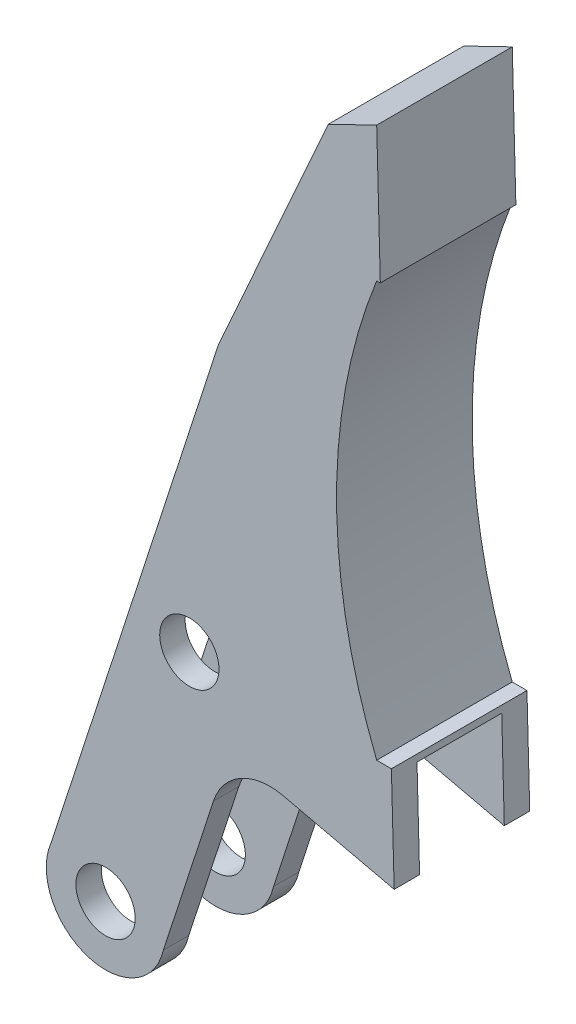
from build123d import *

# Parameters (mm, degrees)
ESTRUSIONE_ESTRUSIONE1_START     = -4
ESTRUSIONE_ESTRUSIONE1_OUTLINE_R = 1.75
ESTRUSIONE_ESTRUSIONE1_DEPTH     = 8
SCHIZZO2_W                       = 5
SCHIZZO2_H                       = 30
TAGLIO_ESTRUSIONE1_DEPTH         = 15


# Read off the part's stored shape, not the designer's step: Estrusione-Estrusione1
with BuildPart() as part:
    # Estrusione-Estrusione1 outline → Estrusione-Estrusione1 (new body)
    with BuildSketch(Plane.XY.offset(ESTRUSIONE_ESTRUSIONE1_START)):
        with BuildLine():
            Line((-25.284658439, 35.888314388), (-18.737560358, 34.376797697))
            Line((-18.737560358, 34.376797697), (-18.90016625, 40.460566904))
            Line((-18.90016625, 40.460566904), (-19.768803662, 40.460566904))
            ThreePointArc((-19.768803662, 40.460566904), (-22.136039573, 52.710253398), (-19.768803662, 64.959939892))
            Line((-19.768803662, 64.959939892), (-19.554981097, 64.959939892))
            Line((-19.554981097, 64.959939892), (-19.767739779, 72.920135539))
            Line((-19.767739779, 72.920135539), (-22.627052267, 71.534084223))
            Line((-22.627052267, 71.534084223), (-29.102672814, 57.04304198))
            Line((-29.102672814, 57.04304198), (-38.990570649, 26.611221593))
            ThreePointArc((-38.990570649, 26.611221593), (-36.850363143, 21.914964836), (-32.358508436, 24.456333953))
            Line((-32.358508436, 24.456333953), (-29.400684937, 33.559578642))
            ThreePointArc((-29.400684937, 33.559578642), (-27.79546959, 35.524264097), (-25.284658439, 35.888314388))
        make_face()
        with Locations((-35.768803662, 25.243662643)):
            Circle(ESTRUSIONE_ESTRUSIONE1_OUTLINE_R, mode=Mode.SUBTRACT)
        with Locations((-30.824531752, 40.460566904)):
            Circle(ESTRUSIONE_ESTRUSIONE1_OUTLINE_R, mode=Mode.SUBTRACT)
    extrude(amount=ESTRUSIONE_ESTRUSIONE1_DEPTH)

    # Schizzo2 → Taglio-Estrusione1 (cut, symmetric)
    with BuildSketch(Plane(origin=(-39.772113155, 12.922742925, 0), x_dir=(0, 0, 1), z_dir=(-0.9510565162951534, 0.3090169943749484, 0))):
        with Locations((0, 17.257936303)):
            Rectangle(SCHIZZO2_W, SCHIZZO2_H)
    extrude(amount=TAGLIO_ESTRUSIONE1_DEPTH, both=True, mode=Mode.SUBTRACT)


solid = part.part
